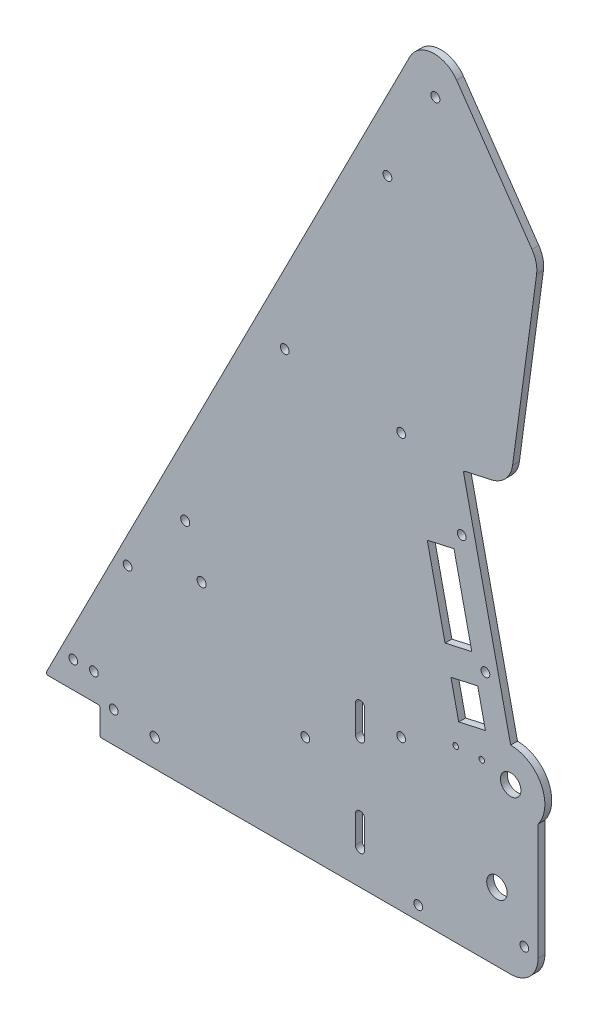
from build123d import *

# Parameters (mm, degrees)
BOSS_EXTRUDE1_DEPTH     = 3.175
SKETCH2_R               = 2.0955
SKETCH2_R_2             = 2.032
SKETCH2_R_3             = 4.7625
CUT_EXTRUDE1_DEPTH      = 421.976111717
SKETCH7_R               = 2.159
CUT_EXTRUDE2_DEPTH      = 421.976111717
CUT_EXTRUDE3_REACH      = 422.976
SKETCH10_R              = 2.032
FILLET1_R               = 12.7
FILLET2_R               = 0.79375
SKETCH12_R              = 2.032
CUT_EXTRUDE5_DEPTH      = 411.989226146
CUT_EXTRUDE6_DEPTH      = 411.989226146
CUT_EXTRUDE6_DEPTH_BACK = 411.989226146
SKETCH13_R              = 1.27
CUT_EXTRUDE7_REACH      = 412.989
SKETCH14_R              = 2.032


with BuildPart() as part:
    # Sketch1 → Boss-Extrude1 (new body)
    with BuildSketch(Plane.XY):
        with BuildLine():
            Line((228.6, -12.7), (228.6, 53.975))
            ThreePointArc((228.6, 53.975), (230.099031657, 70.599515829), (215.9, 79.375))
            Line((215.9, 79.375), (193.909735224, 178.566674323))
            Line((193.909735224, 178.566674323), (215.607913982, 183.377044743))
            Line((215.607913982, 183.377044743), (228.6, 279.4))
            Line((228.6, 279.4), (178.754725958, 351.413083686))
            Line((178.754725958, 351.413083686), (0, 0))
            Line((0, 0), (25.4, 0))
            Line((25.4, 0), (25.4, -12.7))
            Line((25.4, -12.7), (228.6, -12.7))
        make_face()
    extrude(amount=BOSS_EXTRUDE1_DEPTH)

    # Sketch2 → Cut-Extrude1 (cut, through all)
    with BuildSketch(Plane.XY.offset(3.175)):
        with Locations((64.943150167, 94.057839899)):
            Circle(SKETCH2_R)
        with Locations((180.975, 322.164313376)):
            Circle(SKETCH2_R)
        with Locations((72.544547852, 73.173171402)):
            Circle(SKETCH2_R)
        with Locations((193.207821773, 152.394364194)):
            Circle(SKETCH2_R_2)
        with Locations((215.9, 63.5)):
            Circle(SKETCH2_R_3)
        with Locations((173.0375, -6.35)):
            Circle(SKETCH2_R_2)
        with Locations((204.202954161, 102.798527032)):
            Circle(SKETCH2_R_2)
        with Locations((209.55, 19.05)):
            Circle(SKETCH2_R_3)
        with Locations((165.1, 179.3875)):
            Circle(SKETCH2_R_2)
    extrude(amount=-CUT_EXTRUDE1_DEPTH, mode=Mode.SUBTRACT)

    # Sketch7 → Cut-Extrude2 (cut, through all)
    with BuildSketch(Plane.XY.offset(3.175)):
        with Locations((50.8, 0)):
            Circle(SKETCH7_R)
        with BuildLine():
            Line((143.891, 3.175), (143.891, 15.875))
            ThreePointArc((143.891, 15.875), (146.05, 18.034), (148.209, 15.875))
            Line((148.209, 15.875), (148.209, 3.175))
            ThreePointArc((148.209, 3.175), (146.05, 1.016), (143.891, 3.175))
        make_face()
        with BuildLine():
            Line((143.891, 47.625), (143.891, 60.325))
            ThreePointArc((143.891, 60.325), (146.05, 62.484), (148.209, 60.325))
            Line((148.209, 60.325), (148.209, 47.625))
            ThreePointArc((148.209, 47.625), (146.05, 45.466), (143.891, 47.625))
        make_face()
    extrude(amount=-CUT_EXTRUDE2_DEPTH, mode=Mode.SUBTRACT)

    # Sketch10 → Cut-Extrude3 (cut, up to next)
    with BuildSketch(Plane.XY.offset(3.175), mode=Mode.PRIVATE) as cut_extrude3_sk1:
        with Locations((165.1, 57.15)):
            Circle(SKETCH10_R)
    cut_extrude3_tool1 = extrude(cut_extrude3_sk1.sketch, amount=-CUT_EXTRUDE3_REACH, mode=Mode.PRIVATE) & part.part
    # Sketch10 → Cut-Extrude3 (cut, up to next)
    with BuildSketch(Plane.XY.offset(3.175), mode=Mode.PRIVATE) as cut_extrude3_sk2:
        with Locations((120.65, 34.925)):
            Circle(SKETCH10_R)
    cut_extrude3_tool2 = extrude(cut_extrude3_sk2.sketch, amount=-CUT_EXTRUDE3_REACH, mode=Mode.PRIVATE) & part.part
    # Sketch10 → Cut-Extrude3 (cut, up to next)
    with BuildSketch(Plane.XY.offset(3.175), mode=Mode.PRIVATE) as cut_extrude3_sk3:
        with Locations((13.046467246, 12.334704411)):
            Circle(SKETCH10_R)
    cut_extrude3_tool3 = extrude(cut_extrude3_sk3.sketch, amount=-CUT_EXTRUDE3_REACH, mode=Mode.PRIVATE) & part.part
    # Sketch10 → Cut-Extrude3 (cut, up to next)
    with BuildSketch(Plane.XY.offset(3.175), mode=Mode.PRIVATE) as cut_extrude3_sk4:
        with Locations((22.571467246, 12.334704411)):
            Circle(SKETCH10_R)
    cut_extrude3_tool4 = extrude(cut_extrude3_sk4.sketch, amount=-CUT_EXTRUDE3_REACH, mode=Mode.PRIVATE) & part.part
    # Sketch10 → Cut-Extrude3 (cut, up to next)
    with BuildSketch(Plane.XY.offset(3.175), mode=Mode.PRIVATE) as cut_extrude3_sk5:
        with Locations((38.211447917, 62.639810909)):
            Circle(SKETCH10_R)
    cut_extrude3_tool5 = extrude(cut_extrude3_sk5.sketch, amount=-CUT_EXTRUDE3_REACH, mode=Mode.PRIVATE) & part.part
    add(cut_extrude3_tool1.solids().sort_by_distance((165.1, 57.15, 3.175))[0], mode=Mode.SUBTRACT)
    add(cut_extrude3_tool2.solids().sort_by_distance((120.65, 34.925, 3.175))[0], mode=Mode.SUBTRACT)
    add(cut_extrude3_tool3.solids().sort_by_distance((13.046467, 12.334704, 3.175))[0], mode=Mode.SUBTRACT)
    add(cut_extrude3_tool4.solids().sort_by_distance((22.571467, 12.334704, 3.175))[0], mode=Mode.SUBTRACT)
    add(cut_extrude3_tool5.solids().sort_by_distance((38.211448, 62.639811, 3.175))[0], mode=Mode.SUBTRACT)

    # Fillet1
    fillet1_edges = [part.edges().sort_by_distance(p)[0] for p in [
        (228.6, -12.7, 1.5875),
        (178.754725958, 351.413083686, 1.5875),
        (215.607913982, 183.377044743, 1.5875),
        (228.6, 279.4, 1.5875),
    ]]
    fillet(fillet1_edges, radius=FILLET1_R)

    # Fillet2
    fillet2_edges = [part.edges().sort_by_distance(p)[0] for p in [
        (25.4, -12.7, 1.5875),
        (25.4, 0, 1.5875),
        (193.909735224, 178.566674323, 1.5875),
        (0, 0, 1.5875),
    ]]
    fillet(fillet2_edges, radius=FILLET2_R)

    # Sketch12 → Cut-Extrude5 (cut, through all)
    with BuildSketch(Plane.XY.offset(3.175)):
        with Locations((31.75, 1.5875)):
            Circle(SKETCH12_R)
        with Locations((222.25, 1.5875)):
            Circle(SKETCH12_R)
    extrude(amount=-CUT_EXTRUDE5_DEPTH, mode=Mode.SUBTRACT)

    # Sketch13 → Cut-Extrude6 (cut, two sides: drawn at the far end of the back side and taken through both)
    with BuildSketch(Plane.XY.offset(3.175).offset(-CUT_EXTRUDE6_DEPTH_BACK)):
        with Locations((190.426832263, 66.260948917)):
            Circle(SKETCH13_R)
        with Locations((202.533497378, 66.789537331)):
            Circle(SKETCH13_R)
        Polygon((189.622629605, 145.09537131), (197.868978896, 107.898493439), (185.470019606, 105.149710342), (177.223670315, 142.346588213), align=None)
        Polygon((188.218802703, 92.750751051), (200.617761993, 95.499534148), (204.191180019, 79.380887071), (191.792220729, 76.632103974), align=None)
    extrude(amount=CUT_EXTRUDE6_DEPTH + CUT_EXTRUDE6_DEPTH_BACK, mode=Mode.SUBTRACT)

    # Sketch14 → Cut-Extrude7 (cut, up to next)
    with BuildSketch(Plane.XY.offset(3.175), mode=Mode.PRIVATE) as cut_extrude7_sk1:
        with Locations((158.75, 279.4)):
            Circle(SKETCH14_R)
    cut_extrude7_tool1 = extrude(cut_extrude7_sk1.sketch, amount=-CUT_EXTRUDE7_REACH, mode=Mode.PRIVATE) & part.part
    # Sketch14 → Cut-Extrude7 (cut, up to next)
    with BuildSketch(Plane.XY.offset(3.175), mode=Mode.PRIVATE) as cut_extrude7_sk2:
        with Locations((111.125, 186.055)):
            Circle(SKETCH14_R)
    cut_extrude7_tool2 = extrude(cut_extrude7_sk2.sketch, amount=-CUT_EXTRUDE7_REACH, mode=Mode.PRIVATE) & part.part
    add(cut_extrude7_tool1.solids().sort_by_distance((158.75, 279.4, 3.175))[0], mode=Mode.SUBTRACT)
    add(cut_extrude7_tool2.solids().sort_by_distance((111.125, 186.055, 3.175))[0], mode=Mode.SUBTRACT)


solid = part.part
